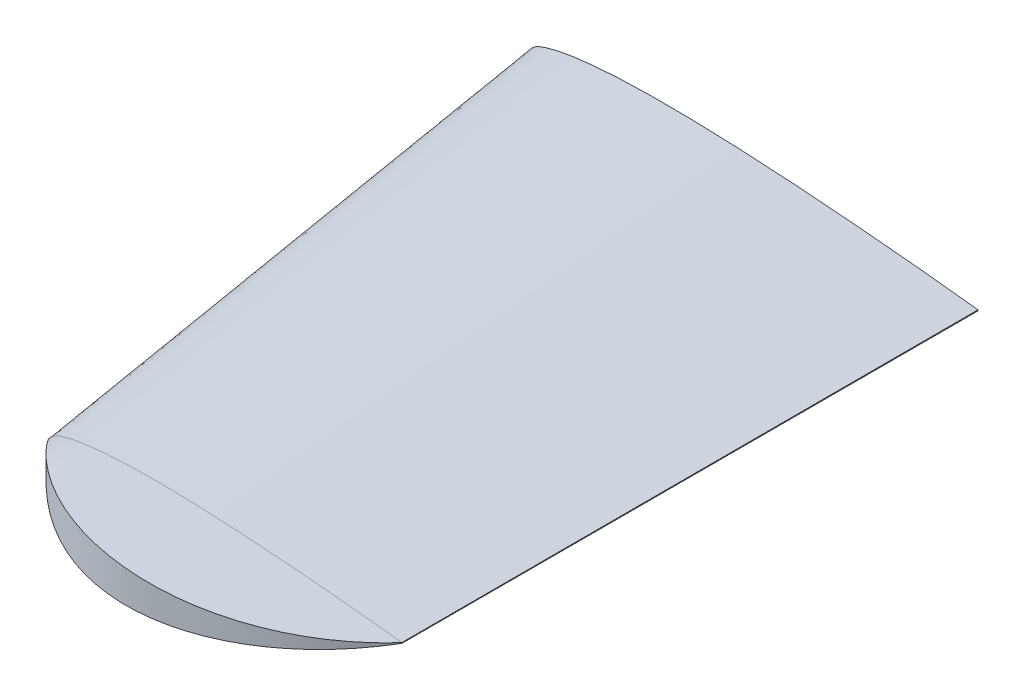
from build123d import *

# Parameters (mm, degrees)
BOSS_EXTRUDE2_DEPTH     = 19
CUT_EXTRUDE1_DEPTH      = 130.58881785
CUT_EXTRUDE1_DEPTH_BACK = 130.58881785


with BuildPart() as part:
    # Boundary2: read off the stored shape, not the designer's step
    # Boundary2: loft between two sections, ruled curve by curve
    boundary2_from = [
        Edge.make_bspline([(70, 0.0735, 0), (68.83350804, 0.207369645, 0), (66.501336661, 0.475015685, 0), (59.506853438, 1.220599503, 0), (51.341129142, 1.973234827, 0), (42.003355076, 2.678142012, 0), (35.003327682, 3.108940887, 0), (28.002842504, 3.415463245, 0), (20.999617681, 3.544127909, 0), (15.162121904, 3.438966863, 0), (10.493247001, 3.142832518, 0), (7.575339389, 2.833247206, 0), (5.240306507, 2.46209865, 0), (3.485305082, 2.099678511, 0), (1.993141445, 1.639208132, 0), (0.755632776, 1.118273181, 0), (-0.447448609, 0, 0), (0.755632776, -1.118273181, 0), (1.993141445, -1.639208132, 0), (3.485305082, -2.099678511, 0), (5.240306507, -2.46209865, 0), (7.575339389, -2.833247206, 0), (10.493247001, -3.142832518, 0), (15.162121904, -3.438966863, 0), (20.999617681, -3.544127909, 0), (28.002842504, -3.415463245, 0), (35.003327682, -3.108940887, 0), (42.003355076, -2.678142012, 0), (51.341129142, -1.973234827, 0), (59.506853438, -1.220599503, 0), (66.501336661, -0.475015685, 0), (68.83350804, -0.207369645, 0), (70, -0.0735, 0)], [0, 0, 0, 0, 0.024823556, 0.049629821, 0.148712653, 0.19818214, 0.247604473, 0.296979943, 0.346317596, 0.39566402, 0.420382182, 0.445198051, 0.457689209, 0.470304283, 0.48322923, 0.490069174, 0.5, 0.509930826, 0.51677077, 0.529695717, 0.542310791, 0.554801949, 0.579617818, 0.60433598, 0.653682404, 0.703020057, 0.752395527, 0.80181786, 0.851287347, 0.950370179, 0.975176444, 1, 1, 1, 1], 3),
        Edge.make_line((70, -0.0735, 0), (70, 0.0735, 0)),
    ]
    boundary2_to = [
        Edge.make_bspline([(70, 0.05775, 90), (69.083470603, 0.162933292, 90), (67.251050234, 0.373226609, 90), (61.755384844, 0.959042467, 90), (55.339458612, 1.550398792, 90), (48.002636131, 2.104254438, 90), (42.502614608, 2.442739269, 90), (37.002233396, 2.683578264, 90), (31.499699607, 2.784671928, 90), (26.913095782, 2.702045392, 90), (23.244694072, 2.469368407, 90), (20.952052377, 2.226122805, 90), (19.117383684, 1.934506082, 90), (17.738453993, 1.649747402, 90), (16.566039707, 1.287949246, 90), (15.593711467, 0.878643213, 90), (14.648433236, 0, 90), (15.593711467, -0.878643213, 90), (16.566039707, -1.287949246, 90), (17.738453993, -1.649747402, 90), (19.117383684, -1.934506082, 90), (20.952052377, -2.226122805, 90), (23.244694072, -2.469368407, 90), (26.913095782, -2.702045392, 90), (31.499699607, -2.784671928, 90), (37.002233396, -2.683578264, 90), (42.502614608, -2.442739269, 90), (48.002636131, -2.104254438, 90), (55.339458612, -1.550398792, 90), (61.755384844, -0.959042467, 90), (67.251050234, -0.373226609, 90), (69.083470603, -0.162933292, 90), (70, -0.05775, 90)], [0, 0, 0, 0, 0.024823556, 0.049629821, 0.148712653, 0.19818214, 0.247604473, 0.296979943, 0.346317596, 0.39566402, 0.420382182, 0.445198051, 0.457689209, 0.470304283, 0.48322923, 0.490069174, 0.5, 0.509930826, 0.51677077, 0.529695717, 0.542310791, 0.554801949, 0.579617818, 0.60433598, 0.653682404, 0.703020057, 0.752395527, 0.80181786, 0.851287347, 0.950370179, 0.975176444, 1, 1, 1, 1], 3),
        Edge.make_line((70, -0.05775, 90), (70, 0.05775, 90)),
    ]
    boundary2 = Solid(Shell([*[Face.make_surface_from_curves(boundary2_from[k], boundary2_to[k]) for k in range(2)], Face(Wire(boundary2_from)), Face(Wire(boundary2_to))]))
    add(boundary2)

    # Sketch6 → Boss-Extrude2 (add)
    with BuildSketch(Plane.XY.offset(90)):
        with BuildLine():
            Line((70, -0.05775), (70, 0.05775))
            add(Edge.make_bspline(
                [(70, 0.05775), (69.083470603, 0.162933292), (67.251050234, 0.373226609), (61.755384844, 0.959042467), (55.339458612, 1.550398792), (48.002636131, 2.104254438), (42.502614608, 2.442739269), (37.002233396, 2.683578264), (31.499699607, 2.784671928), (26.913095782, 2.702045392), (23.244694072, 2.469368407), (20.952052377, 2.226122805), (19.117383684, 1.934506082), (17.738453993, 1.649747402), (16.566039707, 1.287949246), (15.593711467, 0.878643213), (14.648433236, 0), (15.593711467, -0.878643213), (16.566039707, -1.287949246), (17.738453993, -1.649747402), (19.117383684, -1.934506082), (20.952052377, -2.226122805), (23.244694072, -2.469368407), (26.913095782, -2.702045392), (31.499699607, -2.784671928), (37.002233396, -2.683578264), (42.502614608, -2.442739269), (48.002636131, -2.104254438), (55.339458612, -1.550398792), (61.755384844, -0.959042467), (67.251050234, -0.373226609), (69.083470603, -0.162933292), (70, -0.05775)],
                knots=[0, 0, 0, 0, 0.024823556, 0.049629821, 0.148712653, 0.19818214, 0.247604473, 0.296979943, 0.346317596, 0.39566402, 0.420382182, 0.445198051, 0.457689209, 0.470304283, 0.48322923, 0.490069174, 0.5, 0.509930826, 0.51677077, 0.529695717, 0.542310791, 0.554801949, 0.579617818, 0.60433598, 0.653682404, 0.703020057, 0.752395527, 0.80181786, 0.851287347, 0.950370179, 0.975176444, 1, 1, 1, 1], degree=3))
        make_face()
    extrude(amount=BOSS_EXTRUDE2_DEPTH)

    # Sketch4 → Cut-Extrude1 (cut, two sides: drawn at the far end of the back side and taken through both)
    with BuildSketch(Plane(origin=(0, 0, 0), x_dir=(1, 0, 0), z_dir=(0, 1, 0)).offset(-CUT_EXTRUDE1_DEPTH_BACK)):
        with BuildLine():
            Line((15, -90), (6.634672558, -90))
            Line((6.634672558, -90), (6.634672558, -117.924323532))
            Line((6.634672558, -117.924323532), (79.743618206, -117.924323532))
            Line((79.743618206, -117.924323532), (79.743618206, -90))
            Line((79.743618206, -90), (70, -90))
            ThreePointArc((70, -90), (42.5, -104.003676272), (15, -90))
        make_face()
    extrude(amount=CUT_EXTRUDE1_DEPTH + CUT_EXTRUDE1_DEPTH_BACK, mode=Mode.SUBTRACT)


solid = part.part
